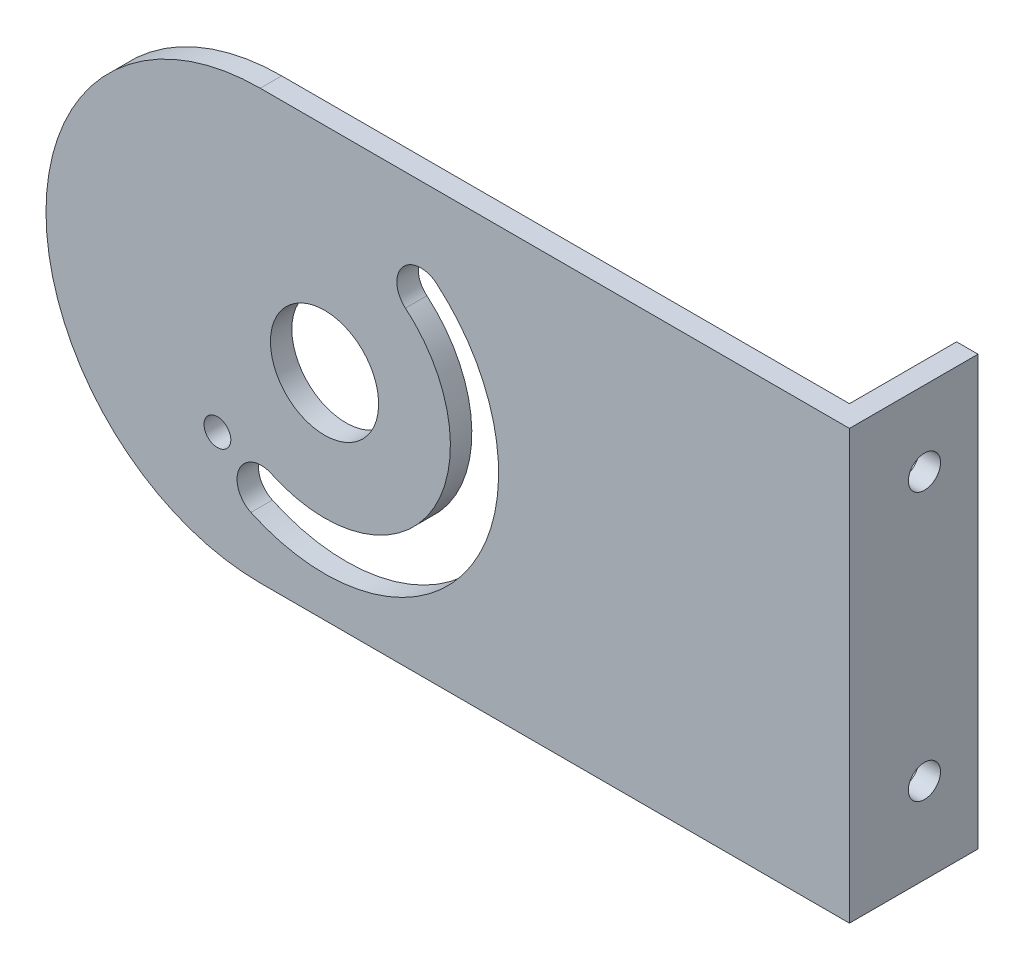
from build123d import *

# Parameters (mm, degrees)
SKETCH_2_W          = 75
SKETCH_2_H          = 40
EXTRUDE_1_DEPTH     = 2
SKETCH_3_R          = 5.05
SKETCH_3_R_2        = 1.25
CUT_EXTRUDE_1_DEPTH = 86.023526156
FILLET_1_R          = 20
SKETCH_7_W          = 2
SKETCH_7_H          = 40
EXTRUDE_3_DEPTH     = 10
SKETCH_10_R         = 1.5
CUT_EXTRUDE_4_DEPTH = 84.839131675


with BuildPart() as part:
    # 草图2 → 凸台-拉伸1 (new body)
    with BuildSketch(Plane.XY):
        with Locations((37.5, 20)):
            Rectangle(SKETCH_2_W, SKETCH_2_H)
    extrude(amount=EXTRUDE_1_DEPTH)

    # 草图3 → 切除-拉伸1 (cut, through all)
    with BuildSketch(Plane(origin=(0, 0, 0), x_dir=(-1, 0, 0), z_dir=(0, 0, -1))):
        with Locations((-26, 20)):
            Circle(SKETCH_3_R)
        with Locations((-16, 10.202041029)):
            Circle(SKETCH_3_R_2)
        with BuildLine():
            ThreePointArc((-36.446428571, 32.447274003), (-39.704318392, 11.267637352), (-19.131116422, 5.273121906))
            ThreePointArc((-19.131116422, 5.273121906), (-18.043086412, 8.263304292), (-21.033268797, 9.351334301))
            ThreePointArc((-21.033268797, 9.351334301), (-35.909276376, 13.685830085), (-33.553571429, 29.000336587))
            ThreePointArc((-33.553571429, 29.000336587), (-33.276531292, 32.170233866), (-36.446428571, 32.447274003))
        make_face()
    extrude(amount=-CUT_EXTRUDE_1_DEPTH, mode=Mode.SUBTRACT)

    # 圆角1
    fillet_1_edges = [part.edges().sort_by_distance(p)[0] for p in [
        (0, 40, 1),
        (0, 0, 1),
    ]]
    fillet(fillet_1_edges, radius=FILLET_1_R - 0.0001)  # a hair under: the kernel refuses the full size

    # 草图7 → 凸台-拉伸3 (add)
    with BuildSketch(Plane(origin=(0, 0, 0), x_dir=(-1, 0, 0), z_dir=(0, 0, -1))):
        with Locations((-74, 20)):
            Rectangle(SKETCH_7_W, SKETCH_7_H)
    extrude(amount=EXTRUDE_3_DEPTH)

    # 草图10 → 切除-拉伸4 (cut, through all)
    with BuildSketch(Plane.ZY.offset(-73)):
        with Locations((-5, 33)):
            Circle(SKETCH_10_R)
        with Locations((-5, 8)):
            Circle(SKETCH_10_R)
    extrude(amount=-CUT_EXTRUDE_4_DEPTH, mode=Mode.SUBTRACT)


solid = part.part
